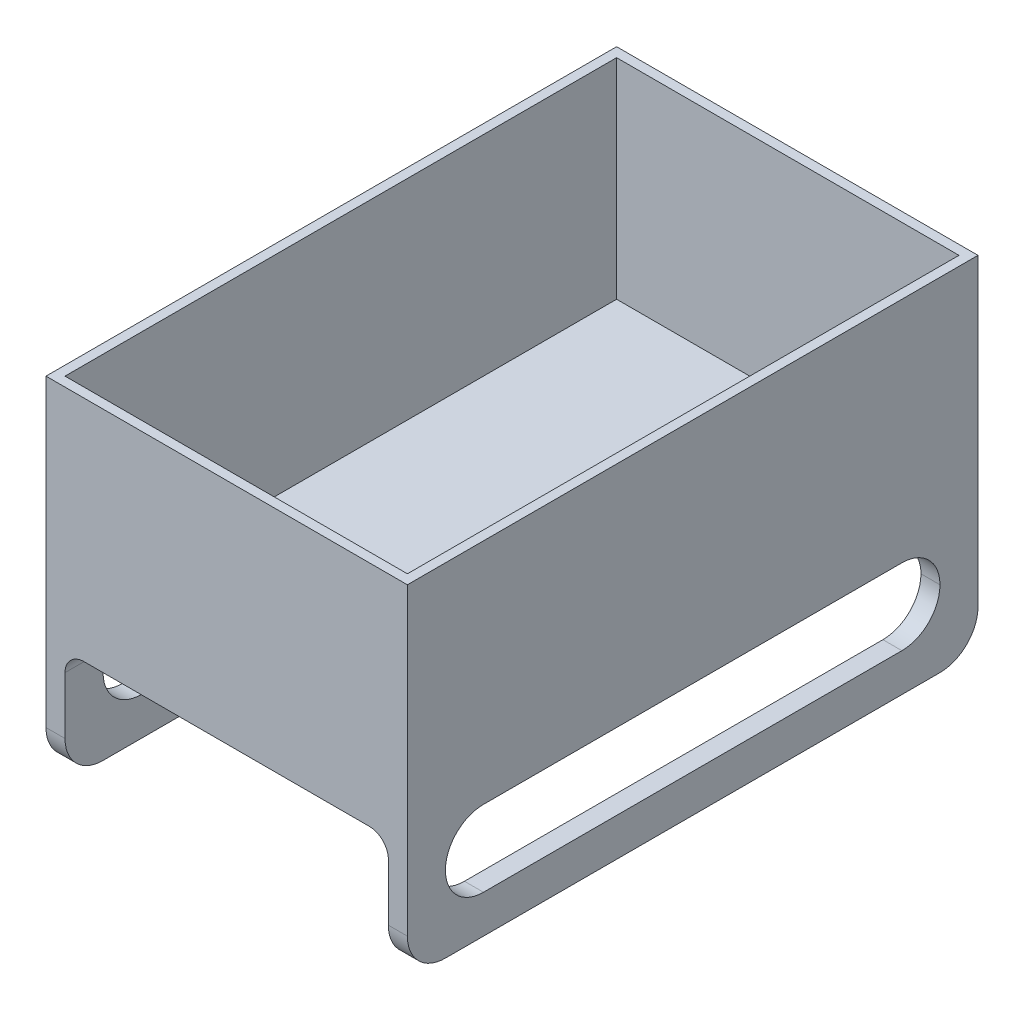
from build123d import *

# Parameters (mm, degrees)
BOSS_EXTRUDE1_DEPTH = 150
FILLET1_R           = 10
CUT_EXTRUDE1_DEPTH  = 200.060292374
FILLET2_R           = 10
SKETCH3_W           = 90
SKETCH3_H           = 145
CUT_EXTRUDE2_DEPTH  = 55
FILLET3_R           = 5


with BuildPart() as part:
    # Sketch1 → Boss-Extrude1 (new body)
    with BuildSketch(Plane.XY):
        Polygon((-47.5, 90), (-47.5, 0), (-42.5, 0), (-42.5, 30), (42.5, 30), (42.5, 0), (47.5, 0), (47.5, 90), align=None)
    extrude(amount=-BOSS_EXTRUDE1_DEPTH)

    # Fillet1
    fillet1_edges = [part.edges().sort_by_distance(p)[0] for p in [
        (-45, 0, 0),
        (45, 0, -150),
        (45, 0, 0),
        (-45, 0, -150),
    ]]
    fillet(fillet1_edges, radius=FILLET1_R)

    # Sketch2 → Cut-Extrude1 (cut, through all)
    with BuildSketch(Plane(origin=(47.5, 0, 0), x_dir=(0, 0, -1), z_dir=(1, 0, 0))):
        with BuildLine():
            Line((140, 20), (140, 30))
            Line((140, 30), (10, 30))
            Line((10, 30), (10, 20))
            ThreePointArc((10, 20), (12.928932188, 12.928932188), (20, 10))
            Line((20, 10), (130, 10))
            ThreePointArc((130, 10), (137.071067812, 12.928932188), (140, 20))
        make_face()
    extrude(amount=-CUT_EXTRUDE1_DEPTH, mode=Mode.SUBTRACT)

    # Fillet2
    fillet2_edges = [part.edges().sort_by_distance(p)[0] for p in [
        (-45, 30, -140),
        (-45, 30, -10),
        (45, 30, -140),
        (45, 30, -10),
    ]]
    fillet(fillet2_edges, radius=FILLET2_R - 0.0001)  # a hair under: the kernel refuses the full size

    # Sketch3 → Cut-Extrude2 (cut)
    with BuildSketch(Plane(origin=(0, 90, 0), x_dir=(1, 0, 0), z_dir=(0, 1, 0))):
        with Locations((0, 75)):
            Rectangle(SKETCH3_W, SKETCH3_H)
    extrude(amount=-CUT_EXTRUDE2_DEPTH, mode=Mode.SUBTRACT)

    # Fillet3
    fillet3_edges = [part.edges().sort_by_distance(p)[0] for p in [
        (42.5, 30, -140.00005),
        (-42.5, 30, -140.00005),
        (-42.5, 30, -9.99995),
        (42.5, 30, -9.99995),
    ]]
    fillet(fillet3_edges, radius=FILLET3_R)


solid = part.part
